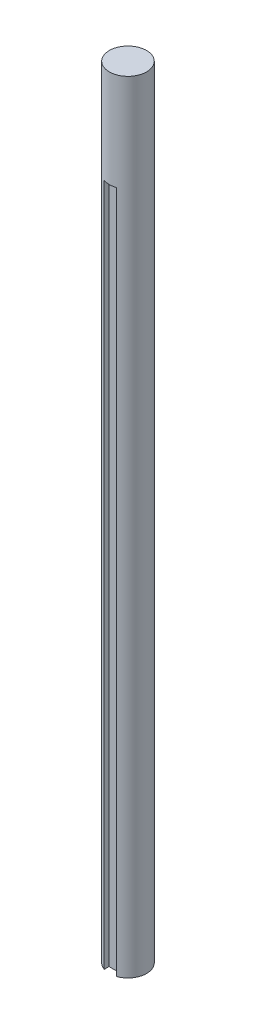
from build123d import *

# Parameters (mm, degrees)
SKETCH1_R           = 4.7625
BOSS_EXTRUDE1_DEPTH = 200
SKETCH2_W           = 3.2
SKETCH2_H           = 3.5
CUT_EXTRUDE1_DEPTH  = 175


with BuildPart() as part:
    # Sketch1 → Boss-Extrude1 (new body)
    with BuildSketch(Plane(origin=(0, 0, 0), x_dir=(1, 0, 0), z_dir=(0, 1, 0))):
        Circle(SKETCH1_R)
    extrude(amount=BOSS_EXTRUDE1_DEPTH)

    # Sketch2 → Cut-Extrude1 (cut, symmetric)
    with BuildSketch(Plane(origin=(0, 0, 0), x_dir=(1, 0, 0), z_dir=(0, 1, 0))):
        with Locations((0, -5.0125)):
            Rectangle(SKETCH2_W, SKETCH2_H)
    extrude(amount=CUT_EXTRUDE1_DEPTH, both=True, mode=Mode.SUBTRACT)


solid = part.part
